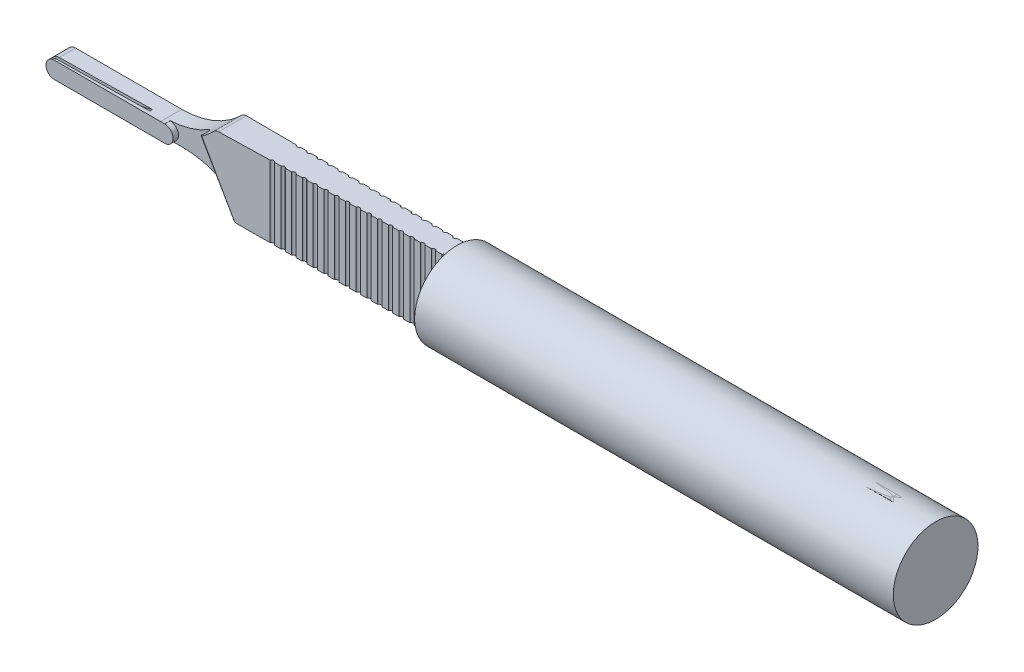
from build123d import *

# Parameters (mm, degrees)
BOSS_EXTRU_1_DEPTH           = 2
CONG_2_R                     = 1
ENL_V_MAT_EXTRU_1_DEPTH      = 1.77
CONG_1_R                     = 0.5
ENL_V_MAT_EXTRU_2_DEPTH      = 120.16794871273063
ENL_V_MAT_EXTRU_2_DEPTH_BACK = 120.16794871273063
ESQUISSE4_OUTSIDE_W          = 152.128
ESQUISSE4_OUTSIDE_H          = 31.128000000000004
ENL_V_MAT_EXTRU_3_DEPTH      = 120.16794871273063
R_P_TITION_START             = -5.329109723
R_P_TITION_LIN_AIRE1_DEPTH   = 10.672345711
ENL_V_MAT_EXTRU_5_DEPTH      = 0.19
BOSS_EXTRU_2_DEPTH           = 6
BOSS_EXTRU_2_DEPTH_BACK      = 61.78718
ESQUISSE9_R                  = 6


# Read off the part's stored shape, not the designer's step: Répétition linéaire1
with BuildPart() as part:
    # Esquisse1 → Boss.-Extru.1 (new, symmetric)
    with BuildSketch(Plane.XY):
        with BuildLine():
            Line((-94, 5.000654392557492), (-0.06380606653039397, 5.999660722563728))
            ThreePointArc((-0.06380606653039397, 5.999660722563728), (5.999999960724106, -0.0006865206484478), (-0.06517902850728707, -5.9996459640751185))
            Line((-0.06517902850728707, -5.9996459640751185), (-91.5, -5.0063152178369394))
            ThreePointArc((-91.5, -5.0063152178369394), (-95.49287183308192, -2.181722820314924), (-100.28117960378982, -1.1850000000000003))
            Line((-100.28117960378982, -1.1850000000000003), (-117.815, -1.185))
            ThreePointArc((-117.815, -1.185), (-119, 1.5e-16), (-117.815, 1.185))
            Line((-117.815, 1.185), (-102.77590376986532, 1.1850000000000003))
            ThreePointArc((-102.77590376986532, 1.1850000000000003), (-97.99114396864803, 2.1801795269229824), (-94, 5.000654392557492))
        make_face()
    extrude(amount=BOSS_EXTRU_1_DEPTH, both=True)

    # Congé2
    cong_2_edges = [part.edges().sort_by_distance(p)[0] for p in [
        (-91.5, -5.006315217836939, 0),
        (-94, 5.000654392557493, 0),
    ]]
    fillet(cong_2_edges, radius=CONG_2_R)

    # Esquisse3 → Enlèv. mat.-Extru.1 (cut)
    with BuildSketch(Plane.XY.offset(2)):
        with BuildLine():
            Line((-97.36861768988254, 4.964829326045353), (-91.6124802044987, -5.005093253991168))
            Line((-91.6124802044987, -5.005093253991168), (-102.18500000000003, -5.00509325399117))
            Line((-102.18500000000003, -5.00509325399117), (-102.18500000000003, -1.185))
            ThreePointArc((-102.18500000000003, -1.185), (-101.00000000000003, 0), (-102.18500000000003, 1.185))
            Line((-102.18500000000003, 1.185), (-102.18500000000003, 4.964829326045353))
            Line((-102.18500000000003, 4.964829326045353), (-97.36861768988254, 4.964829326045353))
        make_face()
    extrude(amount=-ENL_V_MAT_EXTRU_1_DEPTH, mode=Mode.SUBTRACT)

    # Congé1
    cong_1_edges = [part.edges().sort_by_distance(p)[0] for p in [
        (-94.03287302320349, -0.8128499177196291, 0.22999999999999998),
        (-94.03287302320348, -0.8128499177196522, 2),
    ]]
    fillet(cong_1_edges, radius=CONG_1_R)

    # Esquisse4 outside → Enlèv. mat.-Extru.2 (cut, two sides: drawn at the far end of the back side and taken through both)
    with BuildSketch(Plane(origin=(0, 0, 0), x_dir=(1, 0, 0), z_dir=(0, 1, 0)).offset(-ENL_V_MAT_EXTRU_2_DEPTH_BACK)):
        with Locations((-56.5, 0)):
            Rectangle(ESQUISSE4_OUTSIDE_W, ESQUISSE4_OUTSIDE_H)
        Polygon((-119.00000000000001, -1.000000000000003), (-99, -1.000000000000003), (-95.8708882867572, -2), (6, -0.5), (6, 0.5), (-95.8708882867572, 2), (-119.00000000000001, 2), align=None, mode=Mode.SUBTRACT)
    extrude(amount=ENL_V_MAT_EXTRU_2_DEPTH + ENL_V_MAT_EXTRU_2_DEPTH_BACK, mode=Mode.SUBTRACT)

    # Esquisse5 → Enlèv. mat.-Extru.3 (cut, symmetric)
    with BuildSketch(Plane(origin=(0, 0, 0), x_dir=(1, 0, 0), z_dir=(0, 1, 0))):
        with BuildLine():
            Line((-86.38322192363898, 1.8602986605494507), (-85.78322192363899, 1.8514639481489208))
            ThreePointArc((-85.78322192363899, 1.8514639481489208), (-86.08616650857984, 1.6559029819751625), (-86.38322192363898, 1.8602986605494507))
        make_face()
    enl_v_mat_extru_3 = extrude(amount=ENL_V_MAT_EXTRU_3_DEPTH, both=True, mode=Mode.SUBTRACT)

    # Répétition linéaire1 outline → Répétition linéaire1 (cut)
    with BuildSketch(Plane(origin=(0, 0, 0), x_dir=(1, 0, 0), z_dir=(0, 1, 0)).offset(R_P_TITION_START)):
        with BuildLine():
            Line((-84.283469298, 1.82938081), (-84.883469298, 1.838215522))
            ThreePointArc((-84.883469298, 1.838215522), (-84.586413883, 1.633819843), (-84.283469298, 1.82938081))
        make_face()
        with BuildLine():
            Line((-61.787179907, 1.498133732), (-62.387179907, 1.506968444))
            ThreePointArc((-62.387179907, 1.506968444), (-62.090124492, 1.302572765), (-61.787179907, 1.498133732))
        make_face()
        with BuildLine():
            Line((-63.286932533, 1.52021687), (-63.886932533, 1.529051582))
            ThreePointArc((-63.886932533, 1.529051582), (-63.589877118, 1.324655904), (-63.286932533, 1.52021687))
        make_face()
        with BuildLine():
            Line((-64.786685159, 1.542300009), (-65.386685159, 1.551134721))
            ThreePointArc((-65.386685159, 1.551134721), (-65.089629744, 1.346739042), (-64.786685159, 1.542300009))
        make_face()
        with BuildLine():
            Line((-66.286437785, 1.564383147), (-66.886437785, 1.57321786))
            ThreePointArc((-66.886437785, 1.57321786), (-66.58938237, 1.368822181), (-66.286437785, 1.564383147))
        make_face()
        with BuildLine():
            Line((-67.786190411, 1.586466286), (-68.386190411, 1.595300998))
            ThreePointArc((-68.386190411, 1.595300998), (-68.089134996, 1.39090532), (-67.786190411, 1.586466286))
        make_face()
        with BuildLine():
            Line((-69.285943037, 1.608549424), (-69.885943037, 1.617384137))
            ThreePointArc((-69.885943037, 1.617384137), (-69.588887622, 1.412988458), (-69.285943037, 1.608549424))
        make_face()
        with BuildLine():
            Line((-70.785695663, 1.630632563), (-71.385695663, 1.639467275))
            ThreePointArc((-71.385695663, 1.639467275), (-71.088640248, 1.435071597), (-70.785695663, 1.630632563))
        make_face()
        with BuildLine():
            Line((-72.285448289, 1.652715701), (-72.885448289, 1.661550414))
            ThreePointArc((-72.885448289, 1.661550414), (-72.588392874, 1.457154735), (-72.285448289, 1.652715701))
        make_face()
        with BuildLine():
            Line((-73.785200915, 1.67479884), (-74.385200915, 1.683633552))
            ThreePointArc((-74.385200915, 1.683633552), (-74.0881455, 1.479237874), (-73.785200915, 1.67479884))
        make_face()
        with BuildLine():
            Line((-75.284953541, 1.696881978), (-75.884953541, 1.705716691))
            ThreePointArc((-75.884953541, 1.705716691), (-75.587898126, 1.501321012), (-75.284953541, 1.696881978))
        make_face()
        with BuildLine():
            Line((-76.784706168, 1.718965117), (-77.384706168, 1.727799829))
            ThreePointArc((-77.384706168, 1.727799829), (-77.087650753, 1.523404151), (-76.784706168, 1.718965117))
        make_face()
        with BuildLine():
            Line((-78.284458794, 1.741048255), (-78.884458794, 1.749882968))
            ThreePointArc((-78.884458794, 1.749882968), (-78.587403379, 1.545487289), (-78.284458794, 1.741048255))
        make_face()
        with BuildLine():
            Line((-79.78421142, 1.763131394), (-80.38421142, 1.771966106))
            ThreePointArc((-80.38421142, 1.771966106), (-80.087156005, 1.567570428), (-79.78421142, 1.763131394))
        make_face()
        with BuildLine():
            Line((-81.283964046, 1.785214533), (-81.883964046, 1.794049245))
            ThreePointArc((-81.883964046, 1.794049245), (-81.586908631, 1.589653566), (-81.283964046, 1.785214533))
        make_face()
        with BuildLine():
            Line((-82.783716672, 1.807297671), (-83.383716672, 1.816132383))
            ThreePointArc((-83.383716672, 1.816132383), (-83.086661257, 1.611736705), (-82.783716672, 1.807297671))
        make_face()
    r_p_tition_lin_aire1 = extrude(amount=R_P_TITION_LIN_AIRE1_DEPTH, mode=Mode.SUBTRACT)

    # Symétrie1: Enlèv. mat.-Extru.3, Répétition linéaire1 across plane
    add(enl_v_mat_extru_3.mirror(Plane.XY), mode=Mode.SUBTRACT)
    add(r_p_tition_lin_aire1.mirror(Plane.XY), mode=Mode.SUBTRACT)

    # Esquisse8 → Enlèv. mat.-Extru.5 (cut, symmetric)
    with BuildSketch(Plane(origin=(-0.02696303982545021, 0, -1.5447115170486774), x_dir=(0.9998476951563913, 0, -0.01745240643728355), z_dir=(0.01745240643728355, 0, 0.9998476951563913))):
        with BuildLine():
            Line((-117.81450861128754, -0.6849999999999998), (-107.93700761048673, -0.6849999999999998))
            ThreePointArc((-107.93700761048673, -0.6849999999999998), (-106.35586878040255, -0.8107911709342499), (-104.81450861128754, -1.1849999999999998))
            Line((-104.81450861128754, -1.1849999999999998), (-104.81450861128754, -1.6849999999999998))
            Line((-104.81450861128754, -1.6849999999999998), (-117.81450861128754, -1.6849999999999998))
            ThreePointArc((-117.81450861128754, -1.6849999999999998), (-119.49950861128754, 2.1e-16), (-117.81450861128754, 1.685))
            Line((-117.81450861128754, 1.685), (-104.81450861128754, 1.6850000000000016))
            Line((-104.81450861128754, 1.6850000000000016), (-104.81450861128754, 1.185))
            ThreePointArc((-104.81450861128754, 1.185), (-106.35586878040255, 0.8107911709342517), (-107.93700761048673, 0.6850000000000016))
            Line((-107.93700761048673, 0.6850000000000016), (-117.81450861128754, 0.6849999999999999))
            ThreePointArc((-117.81450861128754, 0.6849999999999999), (-118.49950861128754, 8e-17), (-117.81450861128754, -0.6849999999999998))
        make_face()
    extrude(amount=ENL_V_MAT_EXTRU_5_DEPTH, both=True, mode=Mode.SUBTRACT)

    # Esquisse9 → Boss.-Extru.2 (add, two sides: drawn at the far end of the back side and taken through both)
    with BuildSketch(Plane(origin=(0, 0, 0), x_dir=(0, 0, -1), z_dir=(1, 0, 0)).offset(-BOSS_EXTRU_2_DEPTH_BACK)):
        Circle(ESQUISSE9_R)
    extrude(amount=BOSS_EXTRU_2_DEPTH + BOSS_EXTRU_2_DEPTH_BACK)


solid = part.part
